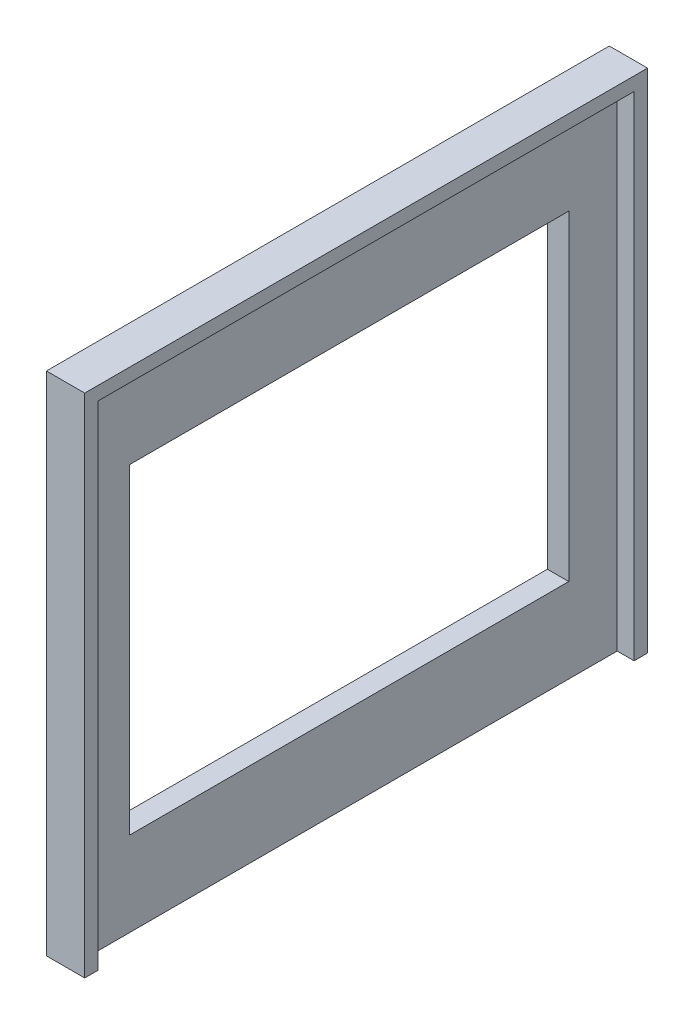
from build123d import *

# Parameters (mm, degrees)
SKETCH1_W           = 500
SKETCH1_H           = 450
SKETCH1_W_2         = 390
SKETCH1_H_2         = 285
BOSS_EXTRUDE1_DEPTH = 19
SKETCH2_W           = 12
SKETCH2_H           = 438
BOSS_EXTRUDE4_DEPTH = 15
SKETCH3_W           = 500
SKETCH3_H           = 12
BOSS_EXTRUDE5_DEPTH = 15
SKETCH4_W           = 12
SKETCH4_H           = 438
BOSS_EXTRUDE6_DEPTH = 15


with BuildPart() as part:
    # Sketch1 → Boss-Extrude1 (new body)
    with BuildSketch(Plane(origin=(0, 0, 0), x_dir=(0, 0, -1), z_dir=(1, 0, 0))):
        with Locations((250, 225)):
            Rectangle(SKETCH1_W, SKETCH1_H)
        with Locations((250, 217.5)):
            Rectangle(SKETCH1_W_2, SKETCH1_H_2, mode=Mode.SUBTRACT)
    extrude(amount=BOSS_EXTRUDE1_DEPTH)

    # Sketch2 → Boss-Extrude4 (add)
    with BuildSketch(Plane(origin=(19, 0, 0), x_dir=(0, 0, -1), z_dir=(1, 0, 0))):
        with Locations((6, 219)):
            Rectangle(SKETCH2_W, SKETCH2_H)
    extrude(amount=BOSS_EXTRUDE4_DEPTH)

    # Sketch3 → Boss-Extrude5 (add)
    with BuildSketch(Plane(origin=(19, 0, 0), x_dir=(0, 0, -1), z_dir=(1, 0, 0))):
        with Locations((250, 444)):
            Rectangle(SKETCH3_W, SKETCH3_H)
    extrude(amount=BOSS_EXTRUDE5_DEPTH)

    # Sketch4 → Boss-Extrude6 (add)
    with BuildSketch(Plane(origin=(19, 0, 0), x_dir=(0, 0, -1), z_dir=(1, 0, 0))):
        with Locations((494, 219)):
            Rectangle(SKETCH4_W, SKETCH4_H)
    extrude(amount=BOSS_EXTRUDE6_DEPTH)


solid = part.part
